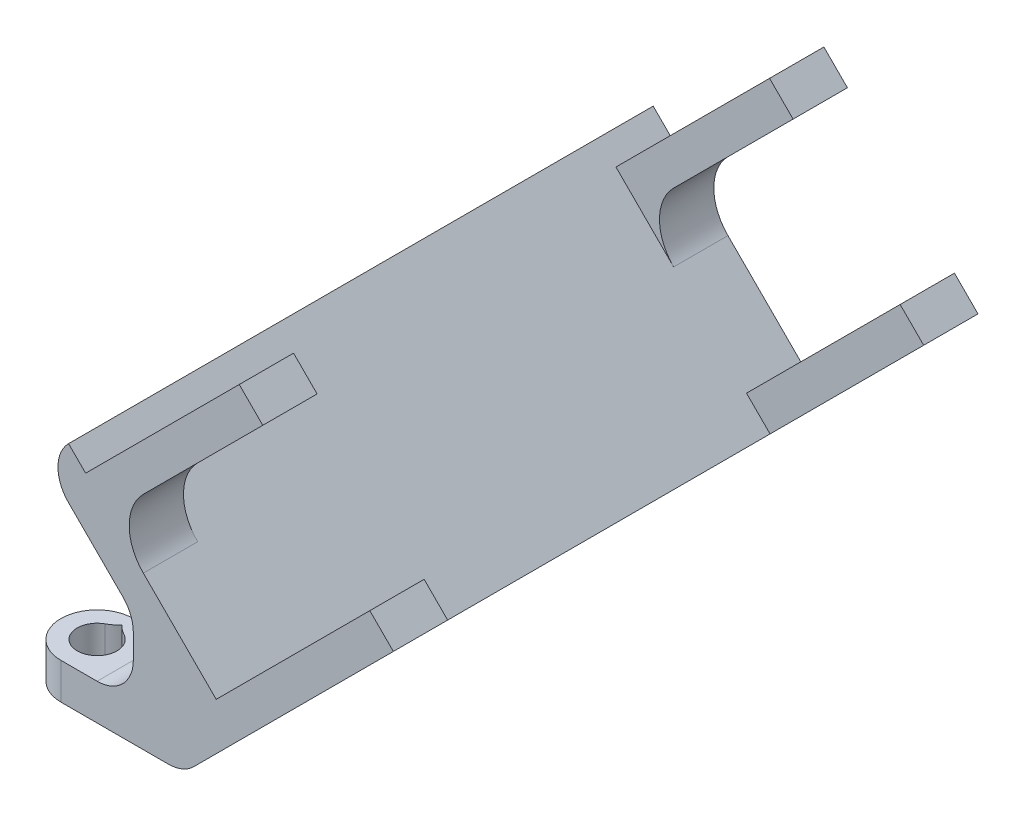
from build123d import *

# Parameters (mm, degrees)
BOSS_EXTRUDE1_DEPTH      = 3
BOSS_EXTRUDE2_DEPTH      = 24.22
BOSS_EXTRUDE2_DEPTH_BACK = 24.22
SKETCH4_W                = 39.44
SKETCH4_H                = 18
CUT_EXTRUDE2_DEPTH       = 49.314655701
FILLET1_R                = 3
FILLET2_R                = 3
FILLET3_R                = 4


with BuildPart() as part:
    # Sketch1 → Boss-Extrude1 (new body)
    with BuildSketch(Plane(origin=(0, 0, 0), x_dir=(1, 0, 0), z_dir=(0, 1, 0))):
        with BuildLine():
            ThreePointArc((-2, 18.983932023), (-1.070466269, 18.417482923), (0, 18.22))
            Line((0, 18.22), (0, -18.22))
            ThreePointArc((0, -18.22), (-1.070466269, -18.417482923), (-2, -18.983932023))
            ThreePointArc((-2, -18.983932023), (-2.802517077, -22.290466269), (0, -24.22))
            Line((0, -24.22), (3, -24.22))
            Line((3, -24.22), (3, 24.22))
            Line((3, 24.22), (0, 24.22))
            ThreePointArc((0, 24.22), (-2.802517077, 22.290466269), (-2, 18.983932023))
        make_face()
        with BuildLine():
            ThreePointArc((0.787400787, -19.77), (1.41804642, -20.376409845), (1.65, -21.22))
            ThreePointArc((1.65, -21.22), (-0.843590155, -22.63804642), (-0.787400787, -19.77))
            ThreePointArc((-0.787400787, -19.77), (-0.370606333, -19.500307136), (0, -19.17))
            ThreePointArc((0, -19.17), (0.370606333, -19.500307136), (0.787400787, -19.77))
        make_face(mode=Mode.SUBTRACT)
        with BuildLine():
            ThreePointArc((0.787400787, 22.67), (1.41804642, 22.063590155), (1.65, 21.22))
            ThreePointArc((1.65, 21.22), (-0.843590155, 19.80195358), (-0.787400787, 22.67))
            ThreePointArc((-0.787400787, 22.67), (-0.370606333, 22.939692864), (0, 23.27))
            ThreePointArc((0, 23.27), (0.370606333, 22.939692864), (0.787400787, 22.67))
        make_face(mode=Mode.SUBTRACT)
    extrude(amount=BOSS_EXTRUDE1_DEPTH)

    # Sketch2 → Boss-Extrude2 (add, two sides: drawn at the far end of the back side and taken through both)
    with BuildSketch(Plane.XY.offset(-BOSS_EXTRUDE2_DEPTH_BACK)):
        Polygon((3, 3), (3, 0), (10.137467504, 0), (27.546655814, 17.409188309), (25.595041097, 19.360803025), (12.867119036, 6.632880964), (4, 15.5), (16.727922061, 28.227922061), (14.776307345, 30.179536777), (2.048385284, 17.451614716), (0.634171722, 18.865828278), (-1.487148622, 16.744507935), (6, 9.257359313), (6, 3), align=None)
    extrude(amount=BOSS_EXTRUDE2_DEPTH + BOSS_EXTRUDE2_DEPTH_BACK)

    # Sketch4 → Cut-Extrude2 (cut, through all)
    with BuildSketch(Plane(origin=(-7.701614716, 7.701614716, 0), x_dir=(0, 0, 1), z_dir=(-0.7071067811865439, 0.7071067811865511, 0))):
        with Locations((0, 22.788582233)):
            Rectangle(SKETCH4_W, SKETCH4_H)
    extrude(amount=-CUT_EXTRUDE2_DEPTH, mode=Mode.SUBTRACT)

    # Fillet1
    fillet1_edges = [part.edges().sort_by_distance(p)[0] for p in [
        (6, 3, 0),
        (6, 9.257359313, 0),
    ]]
    fillet(fillet1_edges, radius=FILLET1_R)

    # Fillet2
    fillet2_edges = [part.edges().sort_by_distance(p)[0] for p in [
        (-1.487148622, 16.744507935, 0),
        (10.137467504, 0, 0),
    ]]
    fillet(fillet2_edges, radius=FILLET2_R - 0.0001)  # a hair under: the kernel refuses the full size

    # Fillet3
    fillet3_edges = [part.edges().sort_by_distance(p)[0] for p in [
        (4, 15.5, -21.97),
        (4, 15.5, 21.97),
    ]]
    fillet(fillet3_edges, radius=FILLET3_R)


solid = part.part
